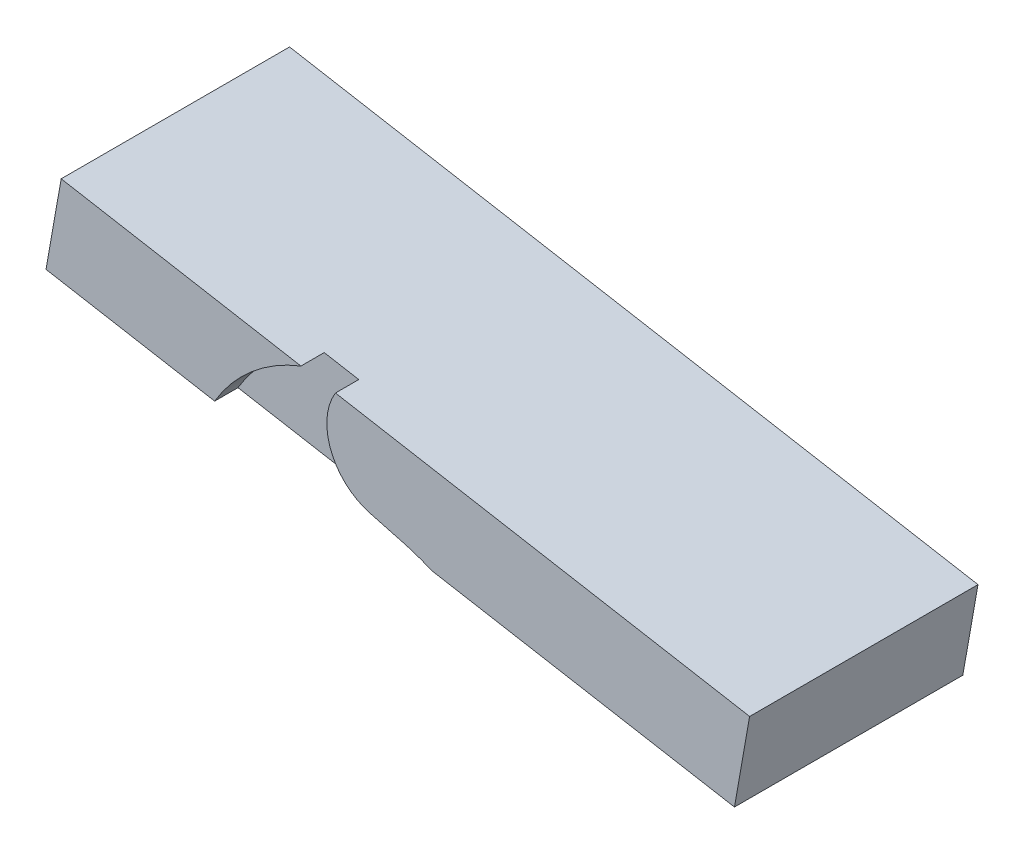
from build123d import *

# Parameters (mm, degrees)
BOSS_EXTRUDE1_DEPTH        = 3.048
BOSS_EXTRUDE2_DEPTH        = 2.032
BOSS_EXTRUDE2_DEPTH_BACK   = 47.752
BOSS_EXTRUDE2_2_DEPTH      = 2.032
BOSS_EXTRUDE2_2_DEPTH_BACK = 47.752


with BuildPart() as part:
    # Sketch1 → Boss-Extrude1 (new, symmetric)
    with BuildSketch(Plane.XY):
        with BuildLine():
            ThreePointArc((0, 27.535484012), (-9.412998127, 39.802742006), (0, 52.07))
            Line((0, 52.07), (-11.040532194, 49.111698314))
            ThreePointArc((-11.040532194, 49.111698314), (-39.066320922, 14.192289272), (-14.190605813, -23.03684931))
            Line((-14.190605813, -23.03684931), (0, -28.201807432))
            ThreePointArc((0, -28.201807432), (8.35634418, -40.135903716), (0, -52.07))
            Line((0, -52.07), (10.740686656, -48.160709762))
            ThreePointArc((10.740686656, -48.160709762), (36.144496882, -10.141220984), (7.52373904, 25.519504212))
            Line((7.52373904, 25.519504212), (0, 27.535484012))
        make_face()
        with BuildLine():
            Line((-12.7, 7.332348419), (-1.374815329, 13.870946837))
            ThreePointArc((-1.374815329, 13.870946837), (-0.410875234, 16.198104087), (1.5875, 14.664696837))
            ThreePointArc((1.5875, 14.664696837), (1.533407249, 14.253821603), (1.374815329, 13.870946837))
            Line((1.374815329, 13.870946837), (12.7, 7.332348419))
            Line((12.7, 7.332348419), (12.7, -7.332348419))
            Line((12.7, -7.332348419), (0, -14.664696837))
            Line((0, -14.664696837), (-12.7, -7.332348419))
            Line((-12.7, -7.332348419), (-12.7, 7.332348419))
        make_face(mode=Mode.SUBTRACT)
    extrude(amount=BOSS_EXTRUDE1_DEPTH, both=True)


with BuildPart() as body_2:
    # Sketch2 → Boss-Extrude2 (new, two sides: drawn at the far end of the back side and taken through both)
    with BuildSketch(Plane.XY.offset(-BOSS_EXTRUDE2_DEPTH_BACK)):
        Polygon((-70.631687067, 38.246108065), (79.453014492, 11.782125788), (82.761012277, 30.542713483), (-67.323689282, 57.00669576), align=None)
    extrude(amount=BOSS_EXTRUDE2_DEPTH + BOSS_EXTRUDE2_DEPTH_BACK)


with BuildPart() as body_3:
    # Sketch2 → Boss-Extrude2 2 (new, two sides: drawn at the far end of the back side and taken through both)
    with BuildSketch(Plane.XY.offset(-BOSS_EXTRUDE2_2_DEPTH_BACK)):
        Polygon((-79.453014492, -11.782125788), (70.631687067, -38.246108065), (67.323689282, -57.00669576), (-82.761012277, -30.542713483), align=None)
    extrude(amount=BOSS_EXTRUDE2_2_DEPTH + BOSS_EXTRUDE2_2_DEPTH_BACK)


with BuildPart() as body_2_1:
    add(body_2.part)

    # Intersect1: read off the stored shape, not the designer's step
    # Intersect1: cut body 3, part
    add(body_3.part, mode=Mode.SUBTRACT)
    add(part.part, mode=Mode.SUBTRACT)


solid = body_2_1.part
